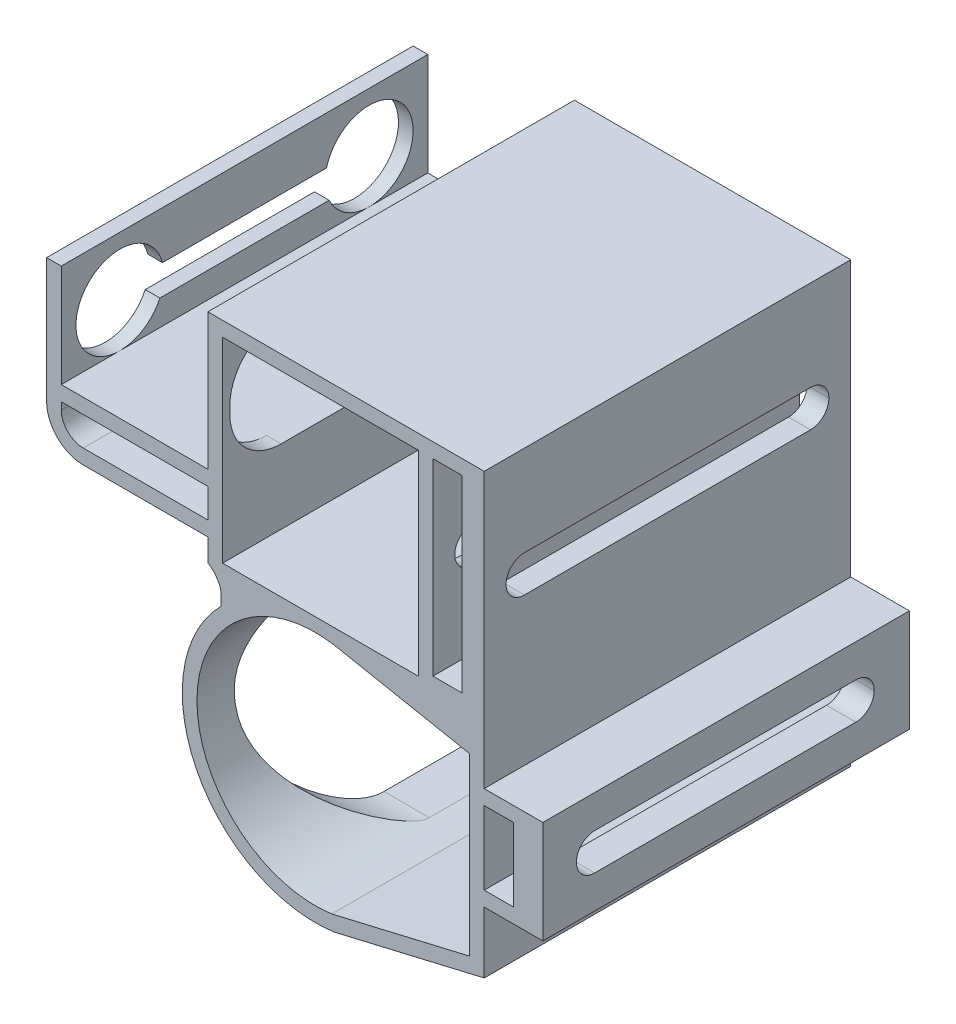
from build123d import *

# Parameters (mm, degrees)
CROQUIS3_W                  = 26.7
CROQUIS3_H                  = 26.7
CROQUIS3_W_2                = 4
CROQUIS3_H_2                = 25.7
CROQUIS3_W_3                = 13.5
CROQUIS3_H_3                = 3.969798642
SALIENTE_EXTRUIR1_DEPTH     = 50
SALIENTE_EXTRUIR2_DEPTH     = 50
CORTAR_EXTRUIR12_REACH      = 94.009
CORTAR_EXTRUIR13_REACH      = 79.272
CROQUIS13_W                 = 48
CROQUIS13_H                 = 15
REDONDEO1_R                 = 2.5
CORTAR_EXTRUIR14_REACH      = 88.292
REDONDEO2_R                 = 2.5
CORTAR_EXTRUIR15_REACH      = 92.548
REDONDEO3_R                 = 5
REDONDEO4_DEPTH             = 50
CORTAR_EXTRUIR17_REACH      = 81.89
CORTAR_EXTRUIR17_END_RADIUS = 16.15
REDONDEO5_R                 = 7
CORTAR_EXTRUIR18_REACH      = 92.661


with BuildPart() as part:
    # Croquis3 → Saliente-Extruir1 (new body)
    with BuildSketch(Plane.XY):
        with BuildLine():
            Line((-63.857247249, 32.580922569), (-63.857247249, 18.580922369))
            Line((-63.857247249, 18.580922369), (-43.857247249, 18.580922369))
            Line((-43.857247249, 18.580922369), (-43.857247249, 37.180922369))
            Line((-43.857247249, 37.180922369), (-27.007247249, 37.180922369))
            Line((-27.007247249, 37.180922369), (-6.157247249, 37.180922369))
            Line((-6.157247249, 37.180922369), (-6.157247249, -22.679560551))
            Line((-6.157247249, -22.679560551), (-26.590955846, -27.481197975))
            ThreePointArc((-26.590955846, -27.481197975), (-45.398833914, -17.697170572), (-42.099195701, 3.245032209))
            Line((-42.099195701, 3.245032209), (-42.099195701, 7.480922369))
            Line((-42.099195701, 7.480922369), (-43.857247249, 7.480922369))
            Line((-43.857247249, 7.480922369), (-43.857247249, 10.580922369))
            Line((-43.857247249, 10.580922369), (-65.856221771, 10.580922369))
            Line((-65.856221771, 10.580922369), (-65.856221771, 16.580922369))
            Line((-65.856221771, 16.580922369), (-65.856221771, 32.580922569))
            Line((-65.856221771, 32.580922569), (-63.857247249, 32.580922569))
        make_face()
        with Locations((-28.507247249, 21.830922369)):
            Rectangle(CROQUIS3_W, CROQUIS3_H, mode=Mode.SUBTRACT)
        with Locations((-11.157247249, 22.330922369)):
            Rectangle(CROQUIS3_W_2, CROQUIS3_H_2, mode=Mode.SUBTRACT)
        with Locations((-50.607247249, 14.56582169)):
            Rectangle(CROQUIS3_W_3, CROQUIS3_H_3, mode=Mode.SUBTRACT)
        with BuildLine():
            Line((-8.157247249, 2.82108494), (-26.731262437, 6.441781026))
            ThreePointArc((-26.731262437, 6.441781026), (-45.345288804, -9.402744466), (-26.961453667, -25.513783269))
            Line((-26.961453667, -25.513783269), (-8.157247249, -21.095056202))
            Line((-8.157247249, -21.095056202), (-8.157247249, 2.82108494))
        make_face(mode=Mode.SUBTRACT)
    extrude(amount=SALIENTE_EXTRUIR1_DEPTH)

    # Croquis11 → Saliente-Extruir2 (add)
    with BuildSketch(Plane(origin=(0, 0, 0), x_dir=(-1, 0, 0), z_dir=(0, 0, -1))):
        Polygon((-1.842752751, -14.302804028), (-1.842752751, -0.302804028), (6.157247249, -0.302804028), (6.157247249, -2.302804028), (2.157247249, -2.302804028), (2.157247249, -12.302804028), (6.157247249, -12.302804028), (6.157247249, -14.302804028), align=None)
    extrude(amount=-SALIENTE_EXTRUIR2_DEPTH)

    # Cortar-Extruir12: up to this face of the body (flat: up to its plane)
    cortar_extruir12_end = Plane(part.part.faces().sort_by_distance((-8.157247249, -9.136985631, 25))[0])
    # Croquis12 → Cortar-Extruir12 (cut, up to the picked face)
    with BuildSketch(Plane(origin=(1.842752751, 0, 0), x_dir=(0, 0, -1), z_dir=(1, 0, 0)), mode=Mode.PRIVATE) as cortar_extruir12_sk1:
        Polygon((-25, -9.802804028), (-4.8, -9.802804028), (-4.8, -4.802804028), (-45.42287301, -4.802804028), (-45.42287301, -9.802804028), align=None)
    cortar_extruir12_tool1 = split(extrude(cortar_extruir12_sk1.sketch, amount=-CORTAR_EXTRUIR12_REACH, mode=Mode.PRIVATE), bisect_by=cortar_extruir12_end, keep=Keep.BOTH, mode=Mode.PRIVATE)
    add(cortar_extruir12_tool1.solids().sort_by(Axis((1.842753, -7.302804, 25.111437), (-1, 0, 0)))[0], mode=Mode.SUBTRACT)

    # Croquis13 → Cortar-Extruir13 (cut, up to next)
    with BuildSketch(Plane.ZY.offset(43.857247249), mode=Mode.PRIVATE) as cortar_extruir13_sk1:
        with Locations((25, 26.080922369)):
            Rectangle(CROQUIS13_W, CROQUIS13_H)
    cortar_extruir13_tool1 = extrude(cortar_extruir13_sk1.sketch, amount=-CORTAR_EXTRUIR13_REACH, mode=Mode.PRIVATE) & part.part
    add(cortar_extruir13_tool1.solids().sort_by_distance((-43.857247, 26.080922, 25))[0], mode=Mode.SUBTRACT)

    # Redondeo1
    redondeo1_edges = [part.edges().sort_by_distance(p)[0] for p in [
        (-0.157247249, -4.802804028, 4.8),
        (-0.157247249, -9.802804028, 4.8),
        (-0.157247249, -9.802804028, 45.42287301),
        (-0.157247249, -4.802804028, 45.42287301),
        (-7.157247249, -9.802804028, 4.8),
        (-7.157247249, -4.802804028, 4.8),
        (-7.157247249, -9.802804028, 45.42287301),
        (-7.157247249, -4.802804028, 45.42287301),
    ]]
    fillet(redondeo1_edges, radius=REDONDEO1_R - 0.0001)  # a hair under: the kernel refuses the full size

    # Cortar-Extruir14: up to this face of the body (flat: up to its plane)
    cortar_extruir14_end = Plane(part.part.faces().sort_by_distance((-15.157247249, 21.830922369, 25))[0])
    # Croquis14 → Cortar-Extruir14 (cut, up to the picked face)
    with BuildSketch(Plane(origin=(-6.157247249, 0, 0), x_dir=(0, 0, -1), z_dir=(1, 0, 0)), mode=Mode.PRIVATE) as cortar_extruir14_sk1:
        Polygon((-2.979356026, 22.330922369), (-2.979356026, 19.830922369), (-47.020643974, 19.830922369), (-47.020643974, 22.330922369), (-47.020643974, 24.830922369), (-2.979356026, 24.830922369), align=None)
    cortar_extruir14_tool1 = split(extrude(cortar_extruir14_sk1.sketch, amount=-CORTAR_EXTRUIR14_REACH, mode=Mode.PRIVATE), bisect_by=cortar_extruir14_end, keep=Keep.BOTH, mode=Mode.PRIVATE)
    add(cortar_extruir14_tool1.solids().sort_by(Axis((-6.157247, 22.330922, 25), (-1, 0, 0)))[0], mode=Mode.SUBTRACT)

    # Redondeo2
    redondeo2_edges = [part.edges().sort_by_distance(p)[0] for p in [
        (-14.157247249, 24.830922369, 2.979356026),
        (-7.657247249, 24.830922369, 2.979356026),
        (-7.657247249, 19.830922369, 2.979356026),
        (-14.157247249, 19.830922369, 2.979356026),
        (-14.157247249, 24.830922369, 47.020643974),
        (-7.657247249, 24.830922369, 47.020643974),
        (-7.657247249, 19.830922369, 47.020643974),
        (-14.157247249, 19.830922369, 47.020643974),
    ]]
    fillet(redondeo2_edges, radius=REDONDEO2_R - 0.0001)  # a hair under: the kernel refuses the full size

    # Croquis15 → Cortar-Extruir15 (cut, up to next)
    with BuildSketch(Plane(origin=(-63.857247249, 0, 0), x_dir=(0, 0, -1), z_dir=(1, 0, 0)), mode=Mode.PRIVATE) as cortar_extruir15_sk1:
        with BuildLine():
            Line((-31, 26.080922569), (-19, 26.080922569))
            Line((-19, 26.080922569), (-13.809474968, 26.080922569))
            ThreePointArc((-13.809474968, 26.080922569), (-2.023506642, 25.111513684), (-13.454356149, 22.080922569))
            Line((-13.454356149, 22.080922569), (-19, 22.080922569))
            Line((-19, 22.080922569), (-31, 22.080922569))
            Line((-31, 22.080922569), (-36.545643851, 22.080922569))
            ThreePointArc((-36.545643851, 22.080922569), (-47.976493358, 25.111513684), (-36.190525032, 26.080922569))
            Line((-36.190525032, 26.080922569), (-31, 26.080922569))
        make_face()
    cortar_extruir15_tool1 = extrude(cortar_extruir15_sk1.sketch, amount=-CORTAR_EXTRUIR15_REACH, mode=Mode.PRIVATE) & part.part
    add(cortar_extruir15_tool1.solids().sort_by_distance((-63.857247, 24.436716, 25))[0], mode=Mode.SUBTRACT)

    # Redondeo3
    redondeo3_edges = [part.edges().sort_by_distance(p)[0] for p in [
        (-65.856221771, 10.580922369, 25),
    ]]
    fillet(redondeo3_edges, radius=REDONDEO3_R)

    # Redondeo4: read off the stored shape, not the designer's step
    # Redondeo4 outline → Redondeo4 (add)
    with BuildSketch(Plane.XY):
        with BuildLine():
            Line((-42.099195701, 7.480922369), (-43.857247249, 7.480922369))
            add(Edge.make_bspline(
                [(-43.857247249, 7.480922369), (-42.099195701, 6.934552825), (-42.099195701, 5.093557191)],
                knots=[0, 0, 0, 1, 1, 1], degree=2, weights=[1, 0.402613242, 1]))
            Line((-42.099195701, 5.093557191), (-42.099195701, 7.480922369))
        make_face()
    extrude(amount=REDONDEO4_DEPTH)

    # Cortar-Extruir17: up to this cylinder (the profile starts outside it)
    cortar_extruir17_end = Plane(origin=(-29.1957078, -9.519077631, 25), z_dir=(0, 0, -1)) * Cylinder(CORTAR_EXTRUIR17_END_RADIUS, 197.08, mode=Mode.PRIVATE)
    # Croquis16 → Cortar-Extruir17 (cut, up to the surface)
    with BuildSketch(Plane.ZY.offset(48.157247249), mode=Mode.PRIVATE) as cortar_extruir17_sk1:
        with BuildLine():
            Line((32, -25.481197975), (18, -25.481197975))
            ThreePointArc((18, -25.481197975), (8.807611845, -21.67358613), (5, -12.481197975))
            Line((5, -12.481197975), (5, -11.754967791))
            ThreePointArc((5, -11.754967791), (8.807611845, -2.562579636), (18, 1.245032209))
            Line((18, 1.245032209), (32, 1.245032209))
            ThreePointArc((32, 1.245032209), (41.192388155, -2.562579636), (45, -11.754967791))
            Line((45, -11.754967791), (45, -12.481197975))
            ThreePointArc((45, -12.481197975), (41.192388155, -21.67358613), (32, -25.481197975))
        make_face()
    cortar_extruir17_tool1 = extrude(cortar_extruir17_sk1.sketch, amount=-CORTAR_EXTRUIR17_REACH, mode=Mode.PRIVATE) - cortar_extruir17_end
    add(cortar_extruir17_tool1.solids().sort_by_distance((-48.157247, -12.118083, 25))[0], mode=Mode.SUBTRACT)

    # Redondeo5
    redondeo5_edges = [part.edges().sort_by_distance(p)[0] for p in [
        (-42.857247249, 18.580922369, 1),
        (-42.857247249, 33.580922369, 1),
        (-42.857247249, 33.580922369, 49),
        (-42.857247249, 18.580922369, 49),
    ]]
    fillet(redondeo5_edges, radius=REDONDEO5_R)

    # Croquis17 → Cortar-Extruir18 (cut, up to next)
    with BuildSketch(Plane(origin=(0, 0, 0), x_dir=(-1, 0, 0), z_dir=(0, 0, -1)), mode=Mode.PRIVATE) as cortar_extruir18_sk1:
        with BuildLine():
            Line((60.856221771, 12.580922369), (57.357247249, 12.580922369))
            Line((57.357247249, 12.580922369), (57.357247249, 16.550721011))
            Line((57.357247249, 16.550721011), (63.856221771, 16.550721011))
            Line((63.856221771, 16.550721011), (63.856221771, 15.580922369))
            ThreePointArc((63.856221771, 15.580922369), (62.977542115, 13.459602026), (60.856221771, 12.580922369))
        make_face()
    cortar_extruir18_tool1 = extrude(cortar_extruir18_sk1.sketch, amount=-CORTAR_EXTRUIR18_REACH, mode=Mode.PRIVATE) & part.part
    add(cortar_extruir18_tool1.solids().sort_by_distance((-60.398011, 14.672215, 0))[0], mode=Mode.SUBTRACT)


solid = part.part
